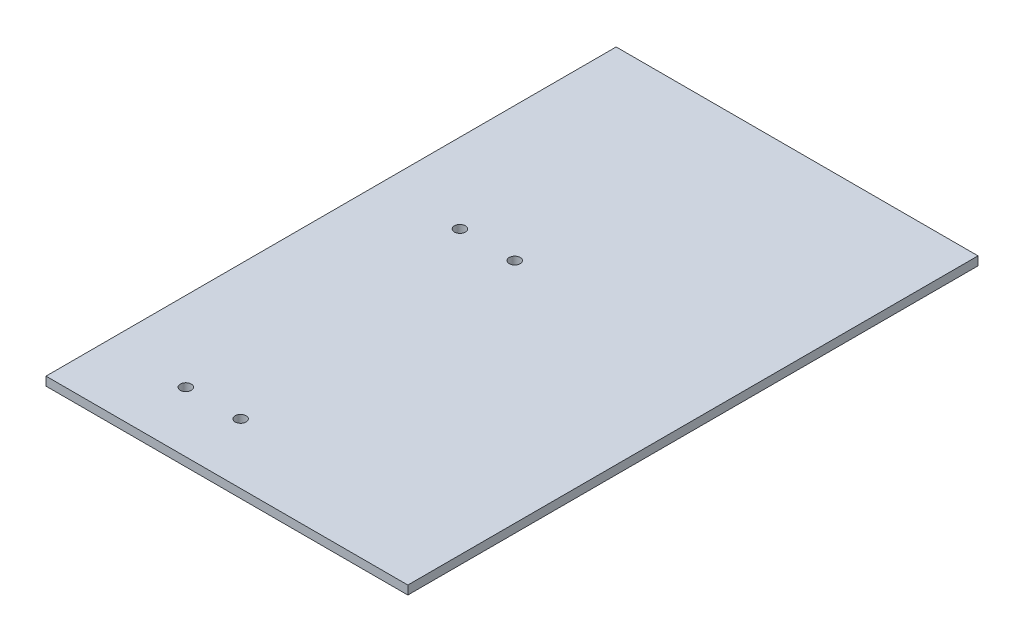
from build123d import *

# Parameters (mm, degrees)
ESQUISSE1_W             = 66
ESQUISSE1_H             = 104
BOSS_EXTRU_1_DEPTH      = 1.5875
ESQUISSE4_R             = 1
ENL_V_MAT_EXTRU_1_DEPTH = 1.5875


with BuildPart() as part:
    # Esquisse1 → Boss.-Extru.1 (new body)
    with BuildSketch(Plane(origin=(0, 0, 0), x_dir=(1, 0, 0), z_dir=(0, 1, 0))):
        Rectangle(ESQUISSE1_W, ESQUISSE1_H)
    extrude(amount=BOSS_EXTRU_1_DEPTH)

    # Esquisse4 → Enlèv. mat.-Extru.1 (cut)
    with BuildSketch(Plane(origin=(0, 1.5875, 0), x_dir=(1, 0, 0), z_dir=(0, 1, 0))):
        with Locations((-18.5, 9)):
            Circle(ESQUISSE4_R)
        with Locations((-8.5, 9)):
            Circle(ESQUISSE4_R)
        with Locations((-8.5, -41)):
            Circle(ESQUISSE4_R)
        with Locations((-18.5, -41)):
            Circle(ESQUISSE4_R)
    extrude(amount=-ENL_V_MAT_EXTRU_1_DEPTH, mode=Mode.SUBTRACT)


solid = part.part
